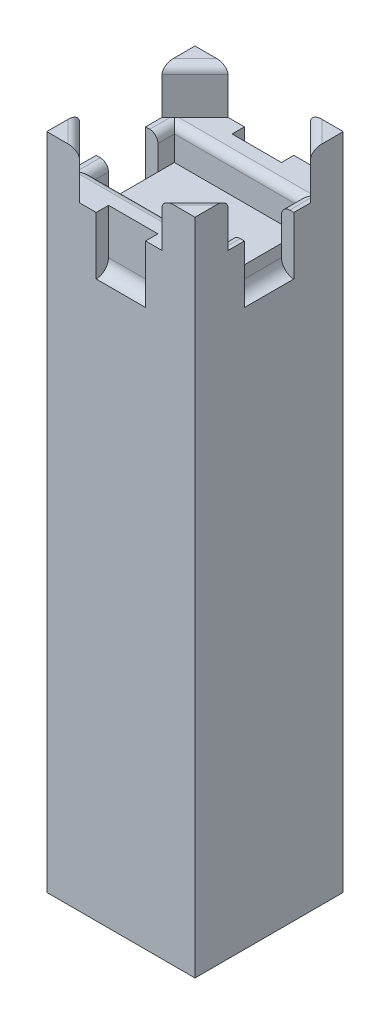
from build123d import *

# Parameters (mm, degrees)
SKETCH1_W           = 18
SKETCH1_H           = 18
BOSS_EXTRUDE1_DEPTH = 80
CUT_EXTRUDE1_DEPTH  = 5.5
SKETCH3_W           = 15
SKETCH3_H           = 10
CUT_EXTRUDE2_DEPTH  = 4
FILLET1_R           = 1
SKETCH4_W           = 6
SKETCH4_H           = 1.5
SKETCH4_W_2         = 1.5
SKETCH4_H_2         = 6
CUT_EXTRUDE3_DEPTH  = 7
FILLET2_R           = 1.5


# Some blends are built 0.0001 mm under size
with BuildPart() as part:
    # Sketch1 → Boss-Extrude1 (new body)
    with BuildSketch(Plane(origin=(0, 0, 0), x_dir=(1, 0, 0), z_dir=(0, 1, 0))):
        Rectangle(SKETCH1_W, SKETCH1_H)
    extrude(amount=BOSS_EXTRUDE1_DEPTH)

    # Sketch2 → Cut-Extrude1 (cut)
    with BuildSketch(Plane(origin=(0, 80, 0), x_dir=(1, 0, 0), z_dir=(0, 1, 0))):
        Polygon((-5, 9), (5, 9), (9, 5), (9, -5), (5, -9), (-5, -9), (-9, -5), (-9, 5), align=None)
    extrude(amount=-CUT_EXTRUDE1_DEPTH, mode=Mode.SUBTRACT)

    # Sketch3 → Cut-Extrude2 (cut)
    with BuildSketch(Plane(origin=(0, 74.5, 0), x_dir=(1, 0, 0), z_dir=(0, 1, 0))):
        Rectangle(SKETCH3_W, SKETCH3_H)
    extrude(amount=-CUT_EXTRUDE2_DEPTH, mode=Mode.SUBTRACT)

    # Fillet1
    # the kernel refuses this fillet: 1 mm, written as the material it takes off along each edge
    with BuildSketch(Plane(origin=(-10.767766953, 80, -3.232233047), x_dir=(0, -1, 0), z_dir=(0.7071067811865476, 0, -0.7071067811865476))) as fillet1_piece_1_section:
        with BuildLine():
            CenterArc((FILLET1_R, FILLET1_R), FILLET1_R, 180, 90)
            Line((0, FILLET1_R), (-FILLET1_R * 0.02, FILLET1_R))
            Line((-FILLET1_R * 0.02, FILLET1_R), (-FILLET1_R * 0.02, -FILLET1_R * 0.02))
            Line((-FILLET1_R * 0.02, -FILLET1_R * 0.02), (FILLET1_R, -FILLET1_R * 0.02))
            Line((FILLET1_R, -FILLET1_R * 0.02), (FILLET1_R, 0))
        make_face()
    fillet1_piece_1 = extrude(amount=10.656854249, mode=Mode.PRIVATE)
    fillet1_piece_1 = split(fillet1_piece_1, bisect_by=Plane(origin=(-9, 79.763052859, -7.147455413), z_dir=(1, 0, 0)), keep=Keep.TOP, mode=Mode.PRIVATE)
    fillet1_piece_1 = split(fillet1_piece_1, bisect_by=Plane(origin=(-7.147455413, 79.763052859, -9), z_dir=(0, 0, 1)), keep=Keep.TOP, mode=Mode.PRIVATE)
    add(fillet1_piece_1, mode=Mode.SUBTRACT)
    with BuildSketch(Plane(origin=(-3.232233047, 80, 10.767766953), x_dir=(0, -1, 0), z_dir=(-0.7071067811865477, 0, -0.7071067811865475))) as fillet1_piece_2_section:
        with BuildLine():
            CenterArc((FILLET1_R, FILLET1_R), FILLET1_R, 180, 90)
            Line((0, FILLET1_R), (-FILLET1_R * 0.02, FILLET1_R))
            Line((-FILLET1_R * 0.02, FILLET1_R), (-FILLET1_R * 0.02, -FILLET1_R * 0.02))
            Line((-FILLET1_R * 0.02, -FILLET1_R * 0.02), (FILLET1_R, -FILLET1_R * 0.02))
            Line((FILLET1_R, -FILLET1_R * 0.02), (FILLET1_R, 0))
        make_face()
    fillet1_piece_2 = extrude(amount=10.656854249, mode=Mode.PRIVATE)
    fillet1_piece_2 = split(fillet1_piece_2, bisect_by=Plane(origin=(-7.147455413, 79.763052859, 9), z_dir=(0, 0, -1)), keep=Keep.TOP, mode=Mode.PRIVATE)
    fillet1_piece_2 = split(fillet1_piece_2, bisect_by=Plane(origin=(-9, 79.763052859, 7.147455413), z_dir=(1, 0, 0)), keep=Keep.TOP, mode=Mode.PRIVATE)
    add(fillet1_piece_2, mode=Mode.SUBTRACT)
    with BuildSketch(Plane(origin=(10.767766953, 80, 3.232233047), x_dir=(0.7071067811865475, 0, 0.7071067811865477), z_dir=(-0.7071067811865477, 0, 0.7071067811865475))) as fillet1_piece_3_section:
        with BuildLine():
            CenterArc((FILLET1_R, -FILLET1_R), FILLET1_R, 90, 90)
            Line((0, -FILLET1_R), (-FILLET1_R * 0.02, -FILLET1_R))
            Line((-FILLET1_R * 0.02, -FILLET1_R), (-FILLET1_R * 0.02, FILLET1_R * 0.02))
            Line((-FILLET1_R * 0.02, FILLET1_R * 0.02), (FILLET1_R, FILLET1_R * 0.02))
            Line((FILLET1_R, FILLET1_R * 0.02), (FILLET1_R, 0))
        make_face()
    fillet1_piece_3 = extrude(amount=10.656854249, mode=Mode.PRIVATE)
    fillet1_piece_3 = split(fillet1_piece_3, bisect_by=Plane(origin=(7.147455413, 79.763052859, 9), z_dir=(0, 0, -1)), keep=Keep.TOP, mode=Mode.PRIVATE)
    fillet1_piece_3 = split(fillet1_piece_3, bisect_by=Plane(origin=(9, 79.763052859, 7.147455413), z_dir=(-1, 0, 0)), keep=Keep.TOP, mode=Mode.PRIVATE)
    add(fillet1_piece_3, mode=Mode.SUBTRACT)
    with BuildSketch(Plane(origin=(3.232233047, 80, -10.767766953), x_dir=(0.7071067811865476, 0, -0.7071067811865476), z_dir=(0.7071067811865476, 0, 0.7071067811865476))) as fillet1_piece_4_section:
        with BuildLine():
            CenterArc((FILLET1_R, -FILLET1_R), FILLET1_R, 90, 90)
            Line((0, -FILLET1_R), (-FILLET1_R * 0.02, -FILLET1_R))
            Line((-FILLET1_R * 0.02, -FILLET1_R), (-FILLET1_R * 0.02, FILLET1_R * 0.02))
            Line((-FILLET1_R * 0.02, FILLET1_R * 0.02), (FILLET1_R, FILLET1_R * 0.02))
            Line((FILLET1_R, FILLET1_R * 0.02), (FILLET1_R, 0))
        make_face()
    fillet1_piece_4 = extrude(amount=10.656854249, mode=Mode.PRIVATE)
    fillet1_piece_4 = split(fillet1_piece_4, bisect_by=Plane(origin=(9, 79.763052859, -7.147455413), z_dir=(-1, 0, 0)), keep=Keep.TOP, mode=Mode.PRIVATE)
    fillet1_piece_4 = split(fillet1_piece_4, bisect_by=Plane(origin=(7.147455413, 79.763052859, -9), z_dir=(0, 0, 1)), keep=Keep.TOP, mode=Mode.PRIVATE)
    add(fillet1_piece_4, mode=Mode.SUBTRACT)
    with BuildSketch(Plane(origin=(7.5, 74.5, -5), x_dir=(1, 0, 0), z_dir=(0, 0, 1)), Plane(origin=(-7.5, 74.5, 5), x_dir=(-1, 0, 0), z_dir=(0, 0, -1))) as fillet1_piece_5:
        with BuildLine():
            CenterArc((FILLET1_R, -FILLET1_R), FILLET1_R, 90, 90)
            Line((0, -FILLET1_R), (-FILLET1_R * 0.02, -FILLET1_R))
            Line((-FILLET1_R * 0.02, -FILLET1_R), (-FILLET1_R * 0.02, FILLET1_R * 0.02))
            Line((-FILLET1_R * 0.02, FILLET1_R * 0.02), (FILLET1_R, FILLET1_R * 0.02))
            Line((FILLET1_R, FILLET1_R * 0.02), (FILLET1_R, 0))
        make_face()
    extrude(amount=10, mode=Mode.SUBTRACT)
    with BuildSketch(Plane(origin=(-7.5, 74.5, -5), x_dir=(0, 0, -1), z_dir=(1, 0, 0)), Plane(origin=(7.5, 74.5, 5), x_dir=(0, 0, 1), z_dir=(-1, 0, 0))) as fillet1_piece_6:
        with BuildLine():
            CenterArc((FILLET1_R, -FILLET1_R), FILLET1_R, 90, 90)
            Line((0, -FILLET1_R), (-FILLET1_R * 0.02, -FILLET1_R))
            Line((-FILLET1_R * 0.02, -FILLET1_R), (-FILLET1_R * 0.02, FILLET1_R * 0.02))
            Line((-FILLET1_R * 0.02, FILLET1_R * 0.02), (FILLET1_R, FILLET1_R * 0.02))
            Line((FILLET1_R, FILLET1_R * 0.02), (FILLET1_R, 0))
        make_face()
    extrude(amount=15, mode=Mode.SUBTRACT)
    with BuildSketch(Plane(origin=(-7.5, 74.5, -5), x_dir=(0, 0, -1), z_dir=(1, 0, 0))) as fillet1_piece_7a_section:
        with BuildLine():
            CenterArc((FILLET1_R, -FILLET1_R), FILLET1_R, 90, 90)
            Line((0, -FILLET1_R), (-FILLET1_R * 0.02, -FILLET1_R))
            Line((-FILLET1_R * 0.02, -FILLET1_R), (-FILLET1_R * 0.02, FILLET1_R * 0.02))
            Line((-FILLET1_R * 0.02, FILLET1_R * 0.02), (FILLET1_R, FILLET1_R * 0.02))
            Line((FILLET1_R, FILLET1_R * 0.02), (FILLET1_R, 0))
        make_face()
    fillet1_piece_7a = extrude(amount=17.5, mode=Mode.PRIVATE)
    fillet1_piece_7a = split(fillet1_piece_7a, bisect_by=Plane(origin=(8.48257281, 74.252046622, -5.51742719), z_dir=(-0.7071067811865476, 0, 0.7071067811865476)), keep=Keep.TOP, mode=Mode.PRIVATE)
    fillet1_piece_7a = split(fillet1_piece_7a, bisect_by=Plane(origin=(7.5, 74.252046622, -5.189902921), z_dir=(1, 0, 0)), keep=Keep.TOP, mode=Mode.PRIVATE)
    with BuildSketch(Plane(origin=(7.5, 74.5, -7.5), x_dir=(1, 0, 0), z_dir=(0, 0, 1))) as fillet1_piece_7b_section:
        with BuildLine():
            CenterArc((FILLET1_R, -FILLET1_R), FILLET1_R, 90, 90)
            Line((0, -FILLET1_R), (-FILLET1_R * 0.02, -FILLET1_R))
            Line((-FILLET1_R * 0.02, -FILLET1_R), (-FILLET1_R * 0.02, FILLET1_R * 0.02))
            Line((-FILLET1_R * 0.02, FILLET1_R * 0.02), (FILLET1_R, FILLET1_R * 0.02))
            Line((FILLET1_R, FILLET1_R * 0.02), (FILLET1_R, 0))
        make_face()
    fillet1_piece_7b = extrude(amount=12.5, mode=Mode.PRIVATE)
    fillet1_piece_7b = split(fillet1_piece_7b, bisect_by=Plane(origin=(8.01742719, 74.252046622, -5.98257281), z_dir=(-0.7071067811865476, 0, 0.7071067811865476)), keep=Keep.TOP, mode=Mode.PRIVATE)
    fillet1_piece_7b = split(fillet1_piece_7b, bisect_by=Plane(origin=(7.689902921, 74.252046622, -5), z_dir=(0, 0, -1)), keep=Keep.TOP, mode=Mode.PRIVATE)
    fillet1_piece_7 = fillet1_piece_7a & fillet1_piece_7b
    add(fillet1_piece_7, mode=Mode.SUBTRACT)
    with BuildSketch(Plane(origin=(7.5, 74.5, -5), x_dir=(1, 0, 0), z_dir=(0, 0, 1))) as fillet1_piece_8a_section:
        with BuildLine():
            CenterArc((FILLET1_R, -FILLET1_R), FILLET1_R, 90, 90)
            Line((0, -FILLET1_R), (-FILLET1_R * 0.02, -FILLET1_R))
            Line((-FILLET1_R * 0.02, -FILLET1_R), (-FILLET1_R * 0.02, FILLET1_R * 0.02))
            Line((-FILLET1_R * 0.02, FILLET1_R * 0.02), (FILLET1_R, FILLET1_R * 0.02))
            Line((FILLET1_R, FILLET1_R * 0.02), (FILLET1_R, 0))
        make_face()
    fillet1_piece_8a = extrude(amount=12.5, mode=Mode.PRIVATE)
    fillet1_piece_8a = split(fillet1_piece_8a, bisect_by=Plane(origin=(8.01742719, 74.252046622, 5.98257281), z_dir=(-0.7071067811865475, 0, -0.7071067811865477)), keep=Keep.TOP, mode=Mode.PRIVATE)
    fillet1_piece_8a = split(fillet1_piece_8a, bisect_by=Plane(origin=(7.689902921, 74.252046622, 5), z_dir=(0, 0, 1)), keep=Keep.TOP, mode=Mode.PRIVATE)
    with BuildSketch(Plane(origin=(10, 74.5, 5), x_dir=(0, 0, 1), z_dir=(-1, 0, 0))) as fillet1_piece_8b_section:
        with BuildLine():
            CenterArc((FILLET1_R, -FILLET1_R), FILLET1_R, 90, 90)
            Line((0, -FILLET1_R), (-FILLET1_R * 0.02, -FILLET1_R))
            Line((-FILLET1_R * 0.02, -FILLET1_R), (-FILLET1_R * 0.02, FILLET1_R * 0.02))
            Line((-FILLET1_R * 0.02, FILLET1_R * 0.02), (FILLET1_R, FILLET1_R * 0.02))
            Line((FILLET1_R, FILLET1_R * 0.02), (FILLET1_R, 0))
        make_face()
    fillet1_piece_8b = extrude(amount=17.5, mode=Mode.PRIVATE)
    fillet1_piece_8b = split(fillet1_piece_8b, bisect_by=Plane(origin=(8.48257281, 74.252046622, 5.51742719), z_dir=(-0.7071067811865475, 0, -0.7071067811865477)), keep=Keep.TOP, mode=Mode.PRIVATE)
    fillet1_piece_8b = split(fillet1_piece_8b, bisect_by=Plane(origin=(7.5, 74.252046622, 5.189902921), z_dir=(1, 0, 0)), keep=Keep.TOP, mode=Mode.PRIVATE)
    fillet1_piece_8 = fillet1_piece_8a & fillet1_piece_8b
    add(fillet1_piece_8, mode=Mode.SUBTRACT)
    with BuildSketch(Plane(origin=(-10, 74.5, -5), x_dir=(0, 0, -1), z_dir=(1, 0, 0))) as fillet1_piece_9a_section:
        with BuildLine():
            CenterArc((FILLET1_R, -FILLET1_R), FILLET1_R, 90, 90)
            Line((0, -FILLET1_R), (-FILLET1_R * 0.02, -FILLET1_R))
            Line((-FILLET1_R * 0.02, -FILLET1_R), (-FILLET1_R * 0.02, FILLET1_R * 0.02))
            Line((-FILLET1_R * 0.02, FILLET1_R * 0.02), (FILLET1_R, FILLET1_R * 0.02))
            Line((FILLET1_R, FILLET1_R * 0.02), (FILLET1_R, 0))
        make_face()
    fillet1_piece_9a = extrude(amount=17.5, mode=Mode.PRIVATE)
    fillet1_piece_9a = split(fillet1_piece_9a, bisect_by=Plane(origin=(-8.48257281, 74.252046622, -5.51742719), z_dir=(0.7071067811865476, 0, 0.7071067811865476)), keep=Keep.TOP, mode=Mode.PRIVATE)
    fillet1_piece_9a = split(fillet1_piece_9a, bisect_by=Plane(origin=(-7.5, 74.252046622, -5.189902921), z_dir=(-1, 0, 0)), keep=Keep.TOP, mode=Mode.PRIVATE)
    with BuildSketch(Plane(origin=(-7.5, 74.5, 5), x_dir=(-1, 0, 0), z_dir=(0, 0, -1))) as fillet1_piece_9b_section:
        with BuildLine():
            CenterArc((FILLET1_R, -FILLET1_R), FILLET1_R, 90, 90)
            Line((0, -FILLET1_R), (-FILLET1_R * 0.02, -FILLET1_R))
            Line((-FILLET1_R * 0.02, -FILLET1_R), (-FILLET1_R * 0.02, FILLET1_R * 0.02))
            Line((-FILLET1_R * 0.02, FILLET1_R * 0.02), (FILLET1_R, FILLET1_R * 0.02))
            Line((FILLET1_R, FILLET1_R * 0.02), (FILLET1_R, 0))
        make_face()
    fillet1_piece_9b = extrude(amount=12.5, mode=Mode.PRIVATE)
    fillet1_piece_9b = split(fillet1_piece_9b, bisect_by=Plane(origin=(-8.01742719, 74.252046622, -5.98257281), z_dir=(0.7071067811865476, 0, 0.7071067811865476)), keep=Keep.TOP, mode=Mode.PRIVATE)
    fillet1_piece_9b = split(fillet1_piece_9b, bisect_by=Plane(origin=(-7.689902921, 74.252046622, -5), z_dir=(0, 0, -1)), keep=Keep.TOP, mode=Mode.PRIVATE)
    fillet1_piece_9 = fillet1_piece_9a & fillet1_piece_9b
    add(fillet1_piece_9, mode=Mode.SUBTRACT)
    with BuildSketch(Plane(origin=(7.5, 74.5, 5), x_dir=(0, 0, 1), z_dir=(-1, 0, 0))) as fillet1_piece_10a_section:
        with BuildLine():
            CenterArc((FILLET1_R, -FILLET1_R), FILLET1_R, 90, 90)
            Line((0, -FILLET1_R), (-FILLET1_R * 0.02, -FILLET1_R))
            Line((-FILLET1_R * 0.02, -FILLET1_R), (-FILLET1_R * 0.02, FILLET1_R * 0.02))
            Line((-FILLET1_R * 0.02, FILLET1_R * 0.02), (FILLET1_R, FILLET1_R * 0.02))
            Line((FILLET1_R, FILLET1_R * 0.02), (FILLET1_R, 0))
        make_face()
    fillet1_piece_10a = extrude(amount=17.5, mode=Mode.PRIVATE)
    fillet1_piece_10a = split(fillet1_piece_10a, bisect_by=Plane(origin=(-8.48257281, 74.252046622, 5.51742719), z_dir=(0.7071067811865475, 0, -0.7071067811865477)), keep=Keep.TOP, mode=Mode.PRIVATE)
    fillet1_piece_10a = split(fillet1_piece_10a, bisect_by=Plane(origin=(-7.5, 74.252046622, 5.189902921), z_dir=(-1, 0, 0)), keep=Keep.TOP, mode=Mode.PRIVATE)
    with BuildSketch(Plane(origin=(-7.5, 74.5, 7.5), x_dir=(-1, 0, 0), z_dir=(0, 0, -1))) as fillet1_piece_10b_section:
        with BuildLine():
            CenterArc((FILLET1_R, -FILLET1_R), FILLET1_R, 90, 90)
            Line((0, -FILLET1_R), (-FILLET1_R * 0.02, -FILLET1_R))
            Line((-FILLET1_R * 0.02, -FILLET1_R), (-FILLET1_R * 0.02, FILLET1_R * 0.02))
            Line((-FILLET1_R * 0.02, FILLET1_R * 0.02), (FILLET1_R, FILLET1_R * 0.02))
            Line((FILLET1_R, FILLET1_R * 0.02), (FILLET1_R, 0))
        make_face()
    fillet1_piece_10b = extrude(amount=12.5, mode=Mode.PRIVATE)
    fillet1_piece_10b = split(fillet1_piece_10b, bisect_by=Plane(origin=(-8.01742719, 74.252046622, 5.98257281), z_dir=(0.7071067811865475, 0, -0.7071067811865477)), keep=Keep.TOP, mode=Mode.PRIVATE)
    fillet1_piece_10b = split(fillet1_piece_10b, bisect_by=Plane(origin=(-7.689902921, 74.252046622, 5), z_dir=(0, 0, 1)), keep=Keep.TOP, mode=Mode.PRIVATE)
    fillet1_piece_10 = fillet1_piece_10a & fillet1_piece_10b
    add(fillet1_piece_10, mode=Mode.SUBTRACT)

    # Sketch4 → Cut-Extrude3 (cut)
    with BuildSketch(Plane(origin=(0, 74.5, 0), x_dir=(1, 0, 0), z_dir=(0, 1, 0))):
        with Locations((0, 8.25)):
            Rectangle(SKETCH4_W, SKETCH4_H)
        with Locations((8.25, 0)):
            Rectangle(SKETCH4_W_2, SKETCH4_H_2)
        with Locations((0, -8.25)):
            Rectangle(SKETCH4_W, SKETCH4_H)
        with Locations((-8.25, 0)):
            Rectangle(SKETCH4_W_2, SKETCH4_H_2)
    extrude(amount=-CUT_EXTRUDE3_DEPTH, mode=Mode.SUBTRACT)

    # Fillet2
    fillet2_edges = [part.edges().sort_by_distance(p)[0] for p in [
        (0, 67.5, -7.5),
        (-7.5, 67.5, 0),
        (0, 67.5, 7.5),
        (7.5, 67.5, 0),
    ]]
    fillet(fillet2_edges, radius=FILLET2_R - 0.0001)  # a hair under: the kernel refuses the full size


solid = part.part
